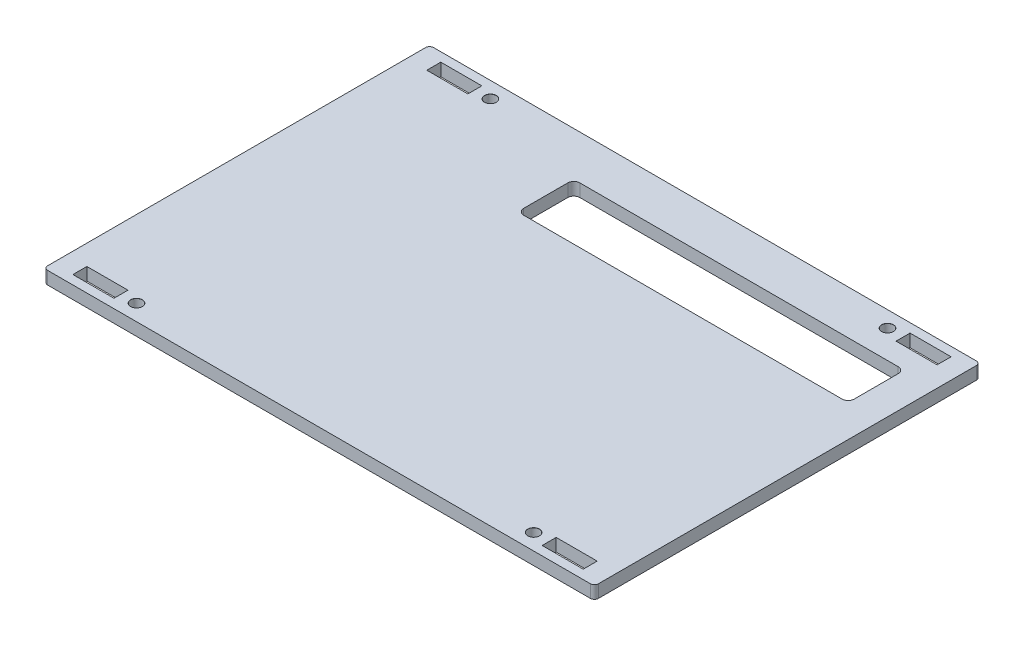
from build123d import *

# Parameters (mm, degrees)
SKETCH1_W                                      = 137.49
SKETCH1_H                                      = 96.345
BOSS_EXTRUDE1_DEPTH                            = 3.175
SKETCH1_3_W                                    = 10.25
SKETCH1_3_H                                    = 3.4925
CUT_EXTRUDE1_DEPTH                             = 85.003246403
M2_5_CLEARANCE_HOLE1_D                         = 2.9
M2_5_CLEARANCE_HOLE1_CSINK_D                   = 2.95
M2_5_CLEARANCE_HOLE1_CSINK_ANGLE               = 100
MIRROR1_AT_THE_SECOND_PLANE_COPY_1_SKETC_W     = 10.25
MIRROR1_AT_THE_SECOND_PLANE_COPY_1_SKETC_H     = 3.4925
MIRROR1_AT_THE_SECOND_PLANE_COPY_1_DEPTH       = 85.003246403
MIRROR1_AT_THE_SECOND_PLANE_COPY_2_D           = 2.9
MIRROR1_AT_THE_SECOND_PLANE_COPY_2_CSINK_D     = 2.95
MIRROR1_AT_THE_SECOND_PLANE_COPY_2_CSINK_ANGLE = 100
CUT_EXTRUDE2_DEPTH                             = 85.003246403
CUT_EXTRUDE2_DEPTH_BACK                        = 85.003246403
SKETCH4_W                                      = 82.49
SKETCH4_H                                      = 14
FILLET1_R                                      = 1.5
FILLET2_R                                      = 1


with BuildPart() as part:
    # Sketch1 → Boss-Extrude1 (new body)
    with BuildSketch(Plane(origin=(0, 0, 0), x_dir=(1, 0, 0), z_dir=(0, 1, 0))):
        Rectangle(SKETCH1_W, SKETCH1_H)
    extrude(amount=BOSS_EXTRUDE1_DEPTH)

    # Sketch1<3> → Cut-Extrude1 (cut, symmetric)
    with BuildSketch(Plane(origin=(0, 0, 0), x_dir=(1, 0, 0), z_dir=(0, 1, 0))):
        with Locations((-58.57, 44.1725)):
            Rectangle(SKETCH1_3_W, SKETCH1_3_H)
    cut_extrude1 = extrude(amount=CUT_EXTRUDE1_DEPTH, both=True, mode=Mode.SUBTRACT)

    # M2.5 Clearance Hole1 (through all)
    with Locations(Plane(origin=(0, 3.175, 0), x_dir=(1, 0, 0), z_dir=(0, 1, 0))):
        with Locations((-49.57, 44.1725)):
            m2_5_clearance_hole1 = CounterSinkHole(M2_5_CLEARANCE_HOLE1_D / 2, M2_5_CLEARANCE_HOLE1_CSINK_D / 2, counter_sink_angle=M2_5_CLEARANCE_HOLE1_CSINK_ANGLE)

    # Mirror1: Cut-Extrude1, M2.5 Clearance Hole1 across plane
    add(cut_extrude1.mirror(Plane(origin=(0, 0, 0), x_dir=(0, 0, 1), z_dir=(1, 0, 0))), mode=Mode.SUBTRACT)
    add(m2_5_clearance_hole1.mirror(Plane(origin=(0, 0, 0), x_dir=(0, 0, 1), z_dir=(1, 0, 0))), mode=Mode.SUBTRACT)

    # Mirror1 at the second plane: Cut-Extrude1, M2.5 Clearance Hole1 across plane
    add(cut_extrude1.mirror(Plane.XY), mode=Mode.SUBTRACT)
    add(m2_5_clearance_hole1.mirror(Plane.XY), mode=Mode.SUBTRACT)

    # Mirror1 at the second plane copy 1 sketc → Mirror1 at the second plane copy 1 (cut, symmetric)
    with BuildSketch(Plane(origin=(0, 0, 0), x_dir=(-1, 0, 0), z_dir=(0, 1, 0))):
        with Locations((-58.57, 44.1725)):
            Rectangle(MIRROR1_AT_THE_SECOND_PLANE_COPY_1_SKETC_W, MIRROR1_AT_THE_SECOND_PLANE_COPY_1_SKETC_H)
    extrude(amount=MIRROR1_AT_THE_SECOND_PLANE_COPY_1_DEPTH, both=True, mode=Mode.SUBTRACT)

    # Mirror1 at the second plane copy 2 (through all)
    with Locations(Plane(origin=(0, 3.175, 0), x_dir=(-1, 0, 0), z_dir=(0, 1, 0))):
        with Locations((-49.57, 44.1725)):
            CounterSinkHole(MIRROR1_AT_THE_SECOND_PLANE_COPY_2_D / 2, MIRROR1_AT_THE_SECOND_PLANE_COPY_2_CSINK_D / 2, counter_sink_angle=MIRROR1_AT_THE_SECOND_PLANE_COPY_2_CSINK_ANGLE)

    # Sketch4 → Cut-Extrude2 (cut, two sides: drawn at the far end of the back side and taken through both)
    with BuildSketch(Plane(origin=(0, 3.175, 0), x_dir=(1, 0, 0), z_dir=(0, 1, 0)).offset(-CUT_EXTRUDE2_DEPTH_BACK)):
        with Locations((19.5, 30.1725)):
            Rectangle(SKETCH4_W, SKETCH4_H)
    extrude(amount=CUT_EXTRUDE2_DEPTH + CUT_EXTRUDE2_DEPTH_BACK, mode=Mode.SUBTRACT)

    # Fillet1
    fillet1_edges = [part.edges().sort_by_distance(p)[0] for p in [
        (-21.745, 1.5875, -23.1725),
        (60.745, 1.5875, -23.1725),
        (60.745, 1.5875, -37.1725),
        (-21.745, 1.5875, -37.1725),
    ]]
    fillet(fillet1_edges, radius=FILLET1_R)

    # Fillet2
    fillet2_edges = [part.edges().sort_by_distance(p)[0] for p in [
        (68.745, 1.5875, 48.1725),
        (-68.745, 1.5875, 48.1725),
        (-68.745, 1.5875, -48.1725),
        (68.745, 1.5875, -48.1725),
    ]]
    fillet(fillet2_edges, radius=FILLET2_R)


solid = part.part
